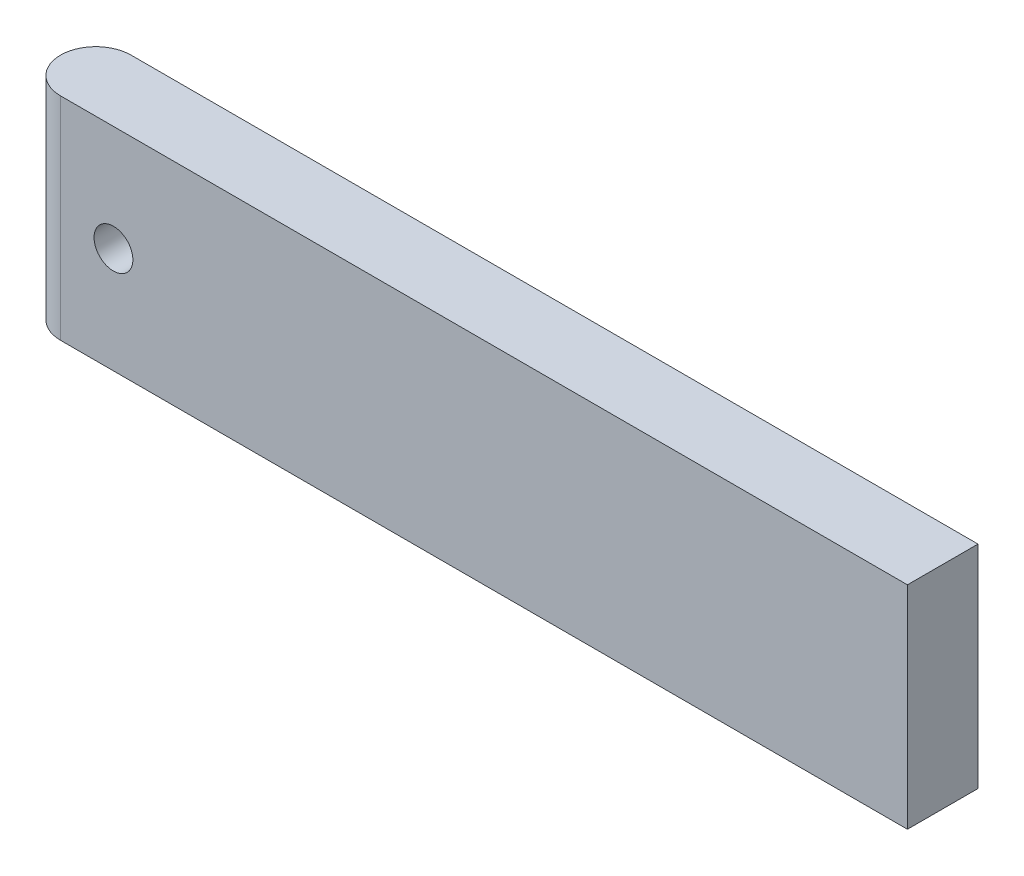
from build123d import *

# Parameters (mm, degrees)
SKETCH1_W           = 10
SKETCH1_H           = 12
SKETCH1_R           = 1.1
BOSS_EXTRUDE1_DEPTH = 4
FILLET1_R           = 2
SKETCH2_W           = 4
SKETCH2_H           = 12
BOSS_EXTRUDE2_DEPTH = 40


with BuildPart() as part:
    # Sketch1 → Boss-Extrude1 (new body)
    with BuildSketch(Plane.XY):
        Rectangle(SKETCH1_W, SKETCH1_H)
        Circle(SKETCH1_R, mode=Mode.SUBTRACT)
    extrude(amount=BOSS_EXTRUDE1_DEPTH)

    # Fillet1
    fillet1_edges = [part.edges().sort_by_distance(p)[0] for p in [
        (-5, 0, 4),
        (-5, 0, 0),
    ]]
    fillet(fillet1_edges, radius=FILLET1_R - 0.0001)  # a hair under: the kernel refuses the full size

    # Sketch2 → Boss-Extrude2 (add)
    with BuildSketch(Plane(origin=(5, 0, 0), x_dir=(0, 0, -1), z_dir=(1, 0, 0))):
        with Locations((-2, 0)):
            Rectangle(SKETCH2_W, SKETCH2_H)
    extrude(amount=BOSS_EXTRUDE2_DEPTH)


solid = part.part
